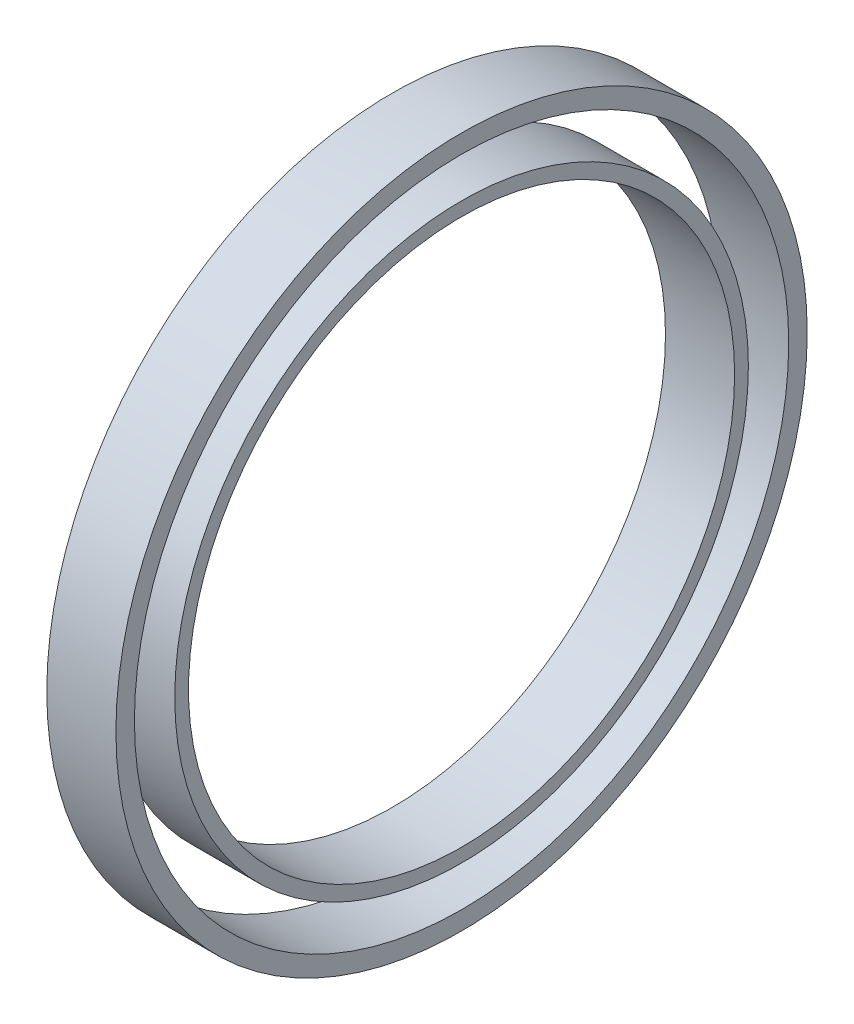
from build123d import *

# Parameters (mm, degrees)
SKETCH1_R           = 25.4
SKETCH1_R_2         = 20.066
BOSS_EXTRUDE1_DEPTH = 5.08
SKETCH2_R           = 24.040986305
SKETCH2_R_2         = 21.076682246
CUT_EXTRUDE1_DEPTH  = 12.7


with BuildPart() as part:
    # Sketch1 → Boss-Extrude1 (new body)
    with BuildSketch(Plane(origin=(0, 0, 0), x_dir=(0, 0, -1), z_dir=(1, 0, 0))):
        Circle(SKETCH1_R)
        Circle(SKETCH1_R_2, mode=Mode.SUBTRACT)
    extrude(amount=BOSS_EXTRUDE1_DEPTH)

    # Sketch2 → Cut-Extrude1 (cut)
    with BuildSketch(Plane.ZY):
        Circle(SKETCH2_R)
        Circle(SKETCH2_R_2, mode=Mode.SUBTRACT)
    extrude(amount=-CUT_EXTRUDE1_DEPTH, mode=Mode.SUBTRACT)


with BuildPart() as cut_extrude1_piece_1:
    # of the separate pieces the step leaves, piece 1, a body of its own (cut_extrude1_pieces)
    add(part.part.solids().sort_by_distance((0, 0, -25.4))[0])


with BuildPart() as cut_extrude1_piece_2:
    # of the separate pieces the step leaves, piece 2, a body of its own (cut_extrude1_pieces)
    add(part.part.solids().sort_by_distance((0, 0, 21.076682246))[0])


solid = Compound([cut_extrude1_piece_1.part, cut_extrude1_piece_2.part])
